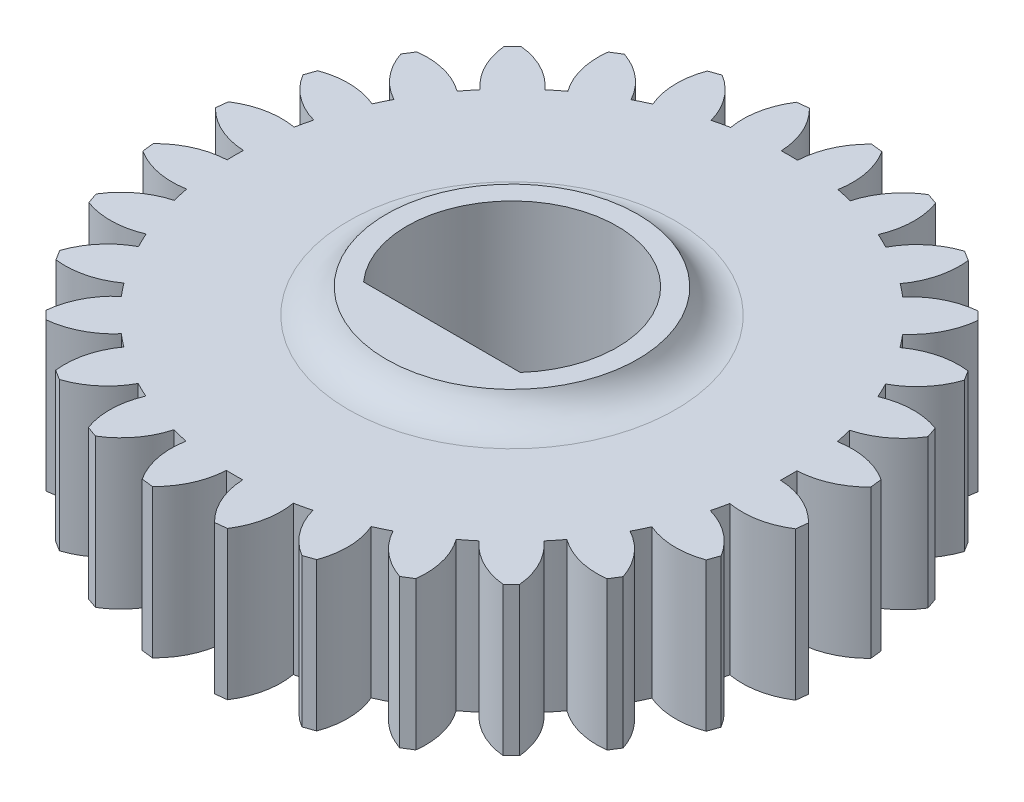
from build123d import *

# Parameters (mm, degrees)
SKETCH1_R           = 2.55
BOSS_EXTRUDE2_DEPTH = 3.6
BOSS_EXTRUDE3_START = -3.6
BOSS_EXTRUDE3_DEPTH = 3.6
SKETCH5_R           = 3.05
BOSS_EXTRUDE6_DEPTH = 0.6
FILLET3_R           = 1


with BuildPart() as part:
    # Sketch1 → Boss-Extrude2 (new body)
    with BuildSketch(Plane(origin=(0, 0, 0), x_dir=(1, 0, 0), z_dir=(0, 1, 0))):
        with BuildLine():
            ThreePointArc((3.087277962, -5.973051053), (3.521946978, -6.509464465), (4.123690803, -6.847962431))
            Line((4.123690803, -6.847962431), (4.363885613, -6.697456058))
            ThreePointArc((4.363885613, -6.697456058), (4.321717278, -6.00832738), (4.02858155, -5.38322903))
            ThreePointArc((4.02858155, -5.38322903), (4.185613137, -5.262059175), (4.339002356, -5.136310217))
            ThreePointArc((4.339002356, -5.136310217), (4.882136527, -5.56255167), (5.544116261, -5.758662187))
            Line((5.544116261, -5.758662187), (5.744798067, -5.55848095))
            ThreePointArc((5.744798067, -5.55848095), (5.550341423, -4.896013504), (5.125457751, -4.35181651))
            ThreePointArc((5.125457751, -4.35181651), (5.251589399, -4.198741821), (5.373151055, -4.042013339))
            ThreePointArc((5.373151055, -4.042013339), (5.997515364, -4.336709306), (6.686536579, -4.380598575))
            Line((6.686536579, -4.380598575), (6.837642357, -4.140780396))
            ThreePointArc((6.837642357, -4.140780396), (6.500648273, -3.538193066), (5.965322098, -3.102185738))
            ThreePointArc((5.965322098, -3.102185738), (6.05422904, -2.924882019), (6.137867523, -2.745033035))
            ThreePointArc((6.137867523, -2.745033035), (6.812153737, -2.893406229), (7.493666033, -2.782873458))
            Line((7.493666033, -2.782873458), (7.587618709, -2.515443823))
            ThreePointArc((7.587618709, -2.515443823), (7.124985474, -2.002952854), (6.506060286, -1.696998421))
            ThreePointArc((6.506060286, -1.696998421), (6.553284356, -1.50435642), (6.594805684, -1.310405312))
            ThreePointArc((6.594805684, -1.310405312), (7.285202277, -1.305015683), (7.925031781, -1.045603446))
            Line((7.925031781, -1.045603446), (7.957120175, -0.763972393))
            ThreePointArc((7.957120175, -0.763972393), (7.392046152, -0.367276222), (6.720557445, -0.206716516))
            ThreePointArc((6.720557445, -0.206716516), (6.723730631, -0.008396108), (6.721052751, 0.189931605))
            ThreePointArc((6.721052751, 0.189931605), (7.392940354, 0.3488138), (7.959003343, 0.744097489))
            Line((7.959003343, 0.744097489), (7.927618409, 1.025807803))
            ThreePointArc((7.927618409, 1.025807803), (7.28843877, 1.286817174), (6.598057791, 1.293931018))
            ThreePointArc((6.598057791, 1.293931018), (6.557020976, 1.487985219), (6.510278168, 1.680744559))
            ThreePointArc((6.510278168, 1.680744559), (7.129965532, 1.985152302), (7.593877244, 2.496486269))
            Line((7.593877244, 2.496486269), (7.500592754, 2.764149712))
            ThreePointArc((7.500592754, 2.764149712), (6.819358634, 2.876384183), (6.144703968, 2.729695448))
            ThreePointArc((6.144703968, 2.729695448), (6.061514909, 2.909752755), (5.973051053, 3.087277962))
            ThreePointArc((5.973051053, 3.087277962), (6.509464465, 3.521946978), (6.847962431, 4.123690803))
            Line((6.847962431, 4.123690803), (6.697456058, 4.363885613))
            ThreePointArc((6.697456058, 4.363885613), (6.00832738, 4.321717278), (5.38322903, 4.02858155))
            ThreePointArc((5.38322903, 4.02858155), (5.262059175, 4.185613137), (5.136310217, 4.339002356))
            ThreePointArc((5.136310217, 4.339002356), (5.56255167, 4.882136527), (5.758662187, 5.544116261))
            Line((5.758662187, 5.544116261), (5.55848095, 5.744798067))
            ThreePointArc((5.55848095, 5.744798067), (4.896013504, 5.550341423), (4.35181651, 5.125457751))
            ThreePointArc((4.35181651, 5.125457751), (4.198741821, 5.251589399), (4.042013339, 5.373151055))
            ThreePointArc((4.042013339, 5.373151055), (4.336709306, 5.997515364), (4.380598575, 6.686536579))
            Line((4.380598575, 6.686536579), (4.140780396, 6.837642357))
            ThreePointArc((4.140780396, 6.837642357), (3.538193066, 6.500648273), (3.102185738, 5.965322098))
            ThreePointArc((3.102185738, 5.965322098), (2.924882019, 6.05422904), (2.745033035, 6.137867523))
            ThreePointArc((2.745033035, 6.137867523), (2.893406229, 6.812153737), (2.782873458, 7.493666033))
            Line((2.782873458, 7.493666033), (2.515443823, 7.587618709))
            ThreePointArc((2.515443823, 7.587618709), (2.002952854, 7.124985474), (1.696998421, 6.506060286))
            ThreePointArc((1.696998421, 6.506060286), (1.50435642, 6.553284356), (1.310405312, 6.594805684))
            ThreePointArc((1.310405312, 6.594805684), (1.305015683, 7.285202277), (1.045603446, 7.925031781))
            Line((1.045603446, 7.925031781), (0.763972393, 7.957120175))
            ThreePointArc((0.763972393, 7.957120175), (0.367276222, 7.392046152), (0.206716516, 6.720557445))
            ThreePointArc((0.206716516, 6.720557445), (0.008396108, 6.723730631), (-0.189931605, 6.721052751))
            ThreePointArc((-0.189931605, 6.721052751), (-0.3488138, 7.392940354), (-0.744097489, 7.959003343))
            Line((-0.744097489, 7.959003343), (-1.025807803, 7.927618409))
            ThreePointArc((-1.025807803, 7.927618409), (-1.286817174, 7.28843877), (-1.293931018, 6.598057791))
            ThreePointArc((-1.293931018, 6.598057791), (-1.487985219, 6.557020976), (-1.680744559, 6.510278168))
            ThreePointArc((-1.680744559, 6.510278168), (-1.985152302, 7.129965532), (-2.496486269, 7.593877244))
            Line((-2.496486269, 7.593877244), (-2.764149712, 7.500592754))
            ThreePointArc((-2.764149712, 7.500592754), (-2.876384183, 6.819358634), (-2.729695448, 6.144703968))
            ThreePointArc((-2.729695448, 6.144703968), (-2.909752755, 6.061514909), (-3.087277962, 5.973051053))
            ThreePointArc((-3.087277962, 5.973051053), (-3.521946978, 6.509464465), (-4.123690803, 6.847962431))
            Line((-4.123690803, 6.847962431), (-4.363885613, 6.697456058))
            ThreePointArc((-4.363885613, 6.697456058), (-4.321717278, 6.00832738), (-4.02858155, 5.38322903))
            ThreePointArc((-4.02858155, 5.38322903), (-4.185613137, 5.262059175), (-4.339002356, 5.136310217))
            ThreePointArc((-4.339002356, 5.136310217), (-4.882136527, 5.56255167), (-5.544116261, 5.758662187))
            Line((-5.544116261, 5.758662187), (-5.744798067, 5.55848095))
            ThreePointArc((-5.744798067, 5.55848095), (-5.550341423, 4.896013504), (-5.125457751, 4.35181651))
            ThreePointArc((-5.125457751, 4.35181651), (-5.251589399, 4.198741821), (-5.373151055, 4.042013339))
            ThreePointArc((-5.373151055, 4.042013339), (-5.997515364, 4.336709306), (-6.686536579, 4.380598575))
            Line((-6.686536579, 4.380598575), (-6.837642357, 4.140780396))
            ThreePointArc((-6.837642357, 4.140780396), (-6.500648273, 3.538193066), (-5.965322098, 3.102185738))
            ThreePointArc((-5.965322098, 3.102185738), (-6.05422904, 2.924882019), (-6.137867523, 2.745033035))
            ThreePointArc((-6.137867523, 2.745033035), (-6.812153737, 2.893406229), (-7.493666033, 2.782873458))
            Line((-7.493666033, 2.782873458), (-7.587618709, 2.515443823))
            ThreePointArc((-7.587618709, 2.515443823), (-7.124985474, 2.002952854), (-6.506060286, 1.696998421))
            ThreePointArc((-6.506060286, 1.696998421), (-6.553284356, 1.50435642), (-6.594805684, 1.310405312))
            ThreePointArc((-6.594805684, 1.310405312), (-7.285202277, 1.305015683), (-7.925031781, 1.045603446))
            Line((-7.925031781, 1.045603446), (-7.957120175, 0.763972393))
            ThreePointArc((-7.957120175, 0.763972393), (-7.392046152, 0.367276222), (-6.720557445, 0.206716516))
            ThreePointArc((-6.720557445, 0.206716516), (-6.723730631, 0.008396108), (-6.721052751, -0.189931605))
            ThreePointArc((-6.721052751, -0.189931605), (-7.392940354, -0.3488138), (-7.959003343, -0.744097489))
            Line((-7.959003343, -0.744097489), (-7.927618409, -1.025807803))
            ThreePointArc((-7.927618409, -1.025807803), (-7.28843877, -1.286817174), (-6.598057791, -1.293931018))
            ThreePointArc((-6.598057791, -1.293931018), (-6.557020976, -1.487985219), (-6.510278168, -1.680744559))
            ThreePointArc((-6.510278168, -1.680744559), (-7.129965532, -1.985152302), (-7.593877244, -2.496486269))
            Line((-7.593877244, -2.496486269), (-7.500592754, -2.764149712))
            ThreePointArc((-7.500592754, -2.764149712), (-6.819358634, -2.876384183), (-6.144703968, -2.729695448))
            ThreePointArc((-6.144703968, -2.729695448), (-6.061514909, -2.909752755), (-5.973051053, -3.087277962))
            ThreePointArc((-5.973051053, -3.087277962), (-6.509464465, -3.521946978), (-6.847962431, -4.123690803))
            Line((-6.847962431, -4.123690803), (-6.697456058, -4.363885613))
            ThreePointArc((-6.697456058, -4.363885613), (-6.00832738, -4.321717278), (-5.38322903, -4.02858155))
            ThreePointArc((-5.38322903, -4.02858155), (-5.262059175, -4.185613137), (-5.136310217, -4.339002356))
            ThreePointArc((-5.136310217, -4.339002356), (-5.56255167, -4.882136527), (-5.758662187, -5.544116261))
            Line((-5.758662187, -5.544116261), (-5.55848095, -5.744798067))
            ThreePointArc((-5.55848095, -5.744798067), (-4.896013504, -5.550341423), (-4.35181651, -5.125457751))
            ThreePointArc((-4.35181651, -5.125457751), (-4.198741821, -5.251589399), (-4.042013339, -5.373151055))
            ThreePointArc((-4.042013339, -5.373151055), (-4.336709306, -5.997515364), (-4.380598575, -6.686536579))
            Line((-4.380598575, -6.686536579), (-4.140780396, -6.837642357))
            ThreePointArc((-4.140780396, -6.837642357), (-3.538193066, -6.500648273), (-3.102185738, -5.965322098))
            ThreePointArc((-3.102185738, -5.965322098), (-2.924882019, -6.05422904), (-2.745033035, -6.137867523))
            ThreePointArc((-2.745033035, -6.137867523), (-2.893406229, -6.812153737), (-2.782873458, -7.493666033))
            Line((-2.782873458, -7.493666033), (-2.515443823, -7.587618709))
            ThreePointArc((-2.515443823, -7.587618709), (-2.002952854, -7.124985474), (-1.696998421, -6.506060286))
            ThreePointArc((-1.696998421, -6.506060286), (-1.50435642, -6.553284356), (-1.310405312, -6.594805684))
            ThreePointArc((-1.310405312, -6.594805684), (-1.305015683, -7.285202277), (-1.045603446, -7.925031781))
            Line((-1.045603446, -7.925031781), (-0.763972393, -7.957120175))
            ThreePointArc((-0.763972393, -7.957120175), (-0.367276222, -7.392046152), (-0.206716516, -6.720557445))
            ThreePointArc((-0.206716516, -6.720557445), (-0.008396108, -6.723730631), (0.189931605, -6.721052751))
            ThreePointArc((0.189931605, -6.721052751), (0.3488138, -7.392940354), (0.744097489, -7.959003343))
            Line((0.744097489, -7.959003343), (1.025807803, -7.927618409))
            ThreePointArc((1.025807803, -7.927618409), (1.286817174, -7.28843877), (1.293931018, -6.598057791))
            ThreePointArc((1.293931018, -6.598057791), (1.487985219, -6.557020976), (1.680744559, -6.510278168))
            ThreePointArc((1.680744559, -6.510278168), (1.985152302, -7.129965532), (2.496486269, -7.593877244))
            Line((2.496486269, -7.593877244), (2.764149712, -7.500592754))
            ThreePointArc((2.764149712, -7.500592754), (2.876384183, -6.819358634), (2.729695448, -6.144703968))
            ThreePointArc((2.729695448, -6.144703968), (2.909752755, -6.061514909), (3.087277962, -5.973051053))
        make_face()
        with Locations(Location((0, 0, 0), (0, 0, 270))):
            Circle(SKETCH1_R, mode=Mode.SUBTRACT)
    extrude(amount=BOSS_EXTRUDE2_DEPTH)

    # Sketch2 → Boss-Extrude3 (add)
    with BuildSketch(Plane(origin=(0, 3.6, 0), x_dir=(1, 0, 0), z_dir=(0, 1, 0)).offset(BOSS_EXTRUDE3_START)):
        with BuildLine():
            Line((-1.900657781, -1.7), (1.900657781, -1.7))
            ThreePointArc((1.900657781, -1.7), (0, -2.55), (-1.900657781, -1.7))
        make_face()
    extrude(amount=BOSS_EXTRUDE3_DEPTH)

    # Sketch5 → Boss-Extrude6 (add)
    with BuildSketch(Plane(origin=(0, 3.6, 0), x_dir=(1, 0, 0), z_dir=(0, 1, 0))):
        with Locations(Location((0, 0, 0), (0, 0, 270))):
            Circle(SKETCH5_R)
        with BuildLine():
            Line((1.900657781, -1.7), (-1.900657781, -1.7))
            ThreePointArc((-1.900657781, -1.7), (0, 2.55), (1.900657781, -1.7))
        make_face(mode=Mode.SUBTRACT)
    extrude(amount=BOSS_EXTRUDE6_DEPTH)

    # Fillet3
    # the kernel refuses this fillet: 1 mm, written as the material it adds along each edge
    with BuildSketch(Plane(origin=(0, 3.6, 0), x_dir=(0, 0, 1), z_dir=(-1, 0, 0))) as fillet3_piece_1:
        with BuildLine():
            CenterArc((3.966515139, 1), FILLET3_R, 203.578178478, 66.421821522)
            Line((3.05, 0.6), (3.031669697, 0.592))
            ThreePointArc((3.031669697, 0.592), (3.03, 0.3), (3.03, 0))
            Line((3.03, 0), (3.05, -0.02))
            Line((3.05, -0.02), (3.966515139, -0.02))
            Line((3.966515139, -0.02), (3.966515139, 0))
        make_face()
    revolve(axis=Axis((0, 3.6, 0), (0, 1, 0)))


solid = part.part
